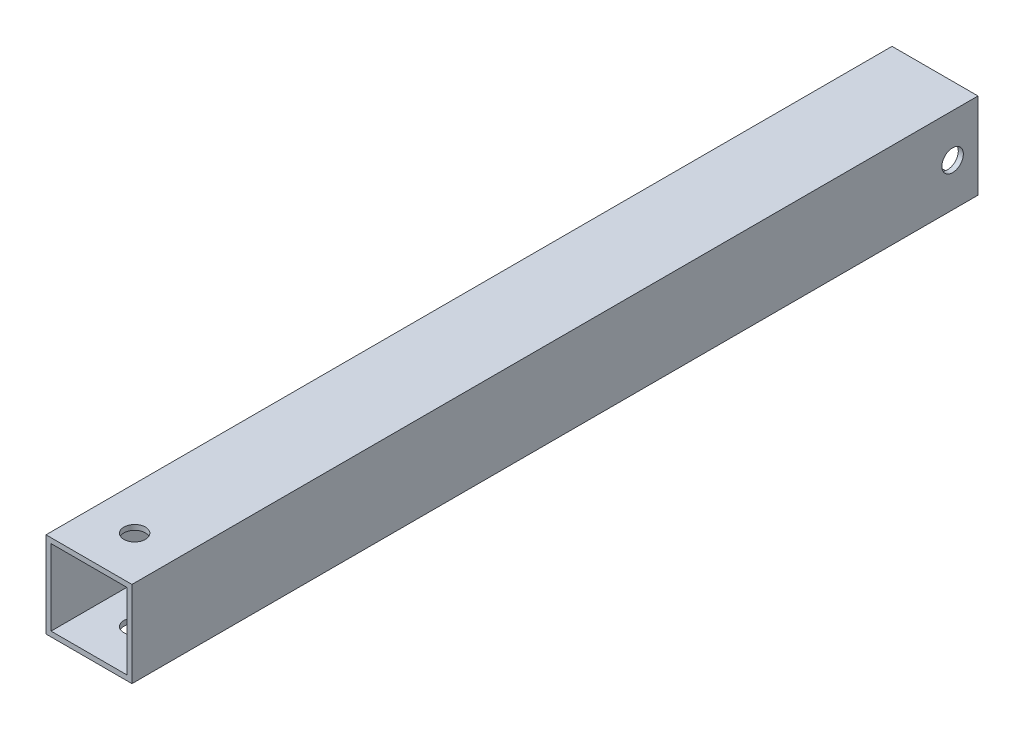
from build123d import *

# Parameters (mm, degrees)
CROQUIS1_W              = 50.8
CROQUIS1_H              = 50.8
CROQUIS1_W_2            = 44.8
CROQUIS1_H_2            = 44.8
SALIENTE_EXTRUIR1_DEPTH = 250
CROQUIS2_R              = 6.35
CORTAR_EXTRUIR1_DEPTH   = 257.370435113
CROQUIS3_R              = 6.35
CORTAR_EXTRUIR2_DEPTH   = 70


with BuildPart() as part:
    # Croquis1 → Saliente-Extruir1 (new, symmetric)
    with BuildSketch(Plane.XY):
        Rectangle(CROQUIS1_W, CROQUIS1_H)
        Rectangle(CROQUIS1_W_2, CROQUIS1_H_2, mode=Mode.SUBTRACT)
    extrude(amount=SALIENTE_EXTRUIR1_DEPTH, both=True)

    # Croquis2 → Cortar-Extruir1 (cut, through all)
    with BuildSketch(Plane(origin=(25.4, 0, 0), x_dir=(0, 0, -1), z_dir=(1, 0, 0))):
        with Locations((235, 0)):
            Circle(CROQUIS2_R)
    extrude(amount=-CORTAR_EXTRUIR1_DEPTH, mode=Mode.SUBTRACT)

    # Croquis3 → Cortar-Extruir2 (cut)
    with BuildSketch(Plane(origin=(0, 25.4, 0), x_dir=(1, 0, 0), z_dir=(0, 1, 0))):
        with Locations((0, -223)):
            Circle(CROQUIS3_R)
    extrude(amount=-CORTAR_EXTRUIR2_DEPTH, mode=Mode.SUBTRACT)


solid = part.part
